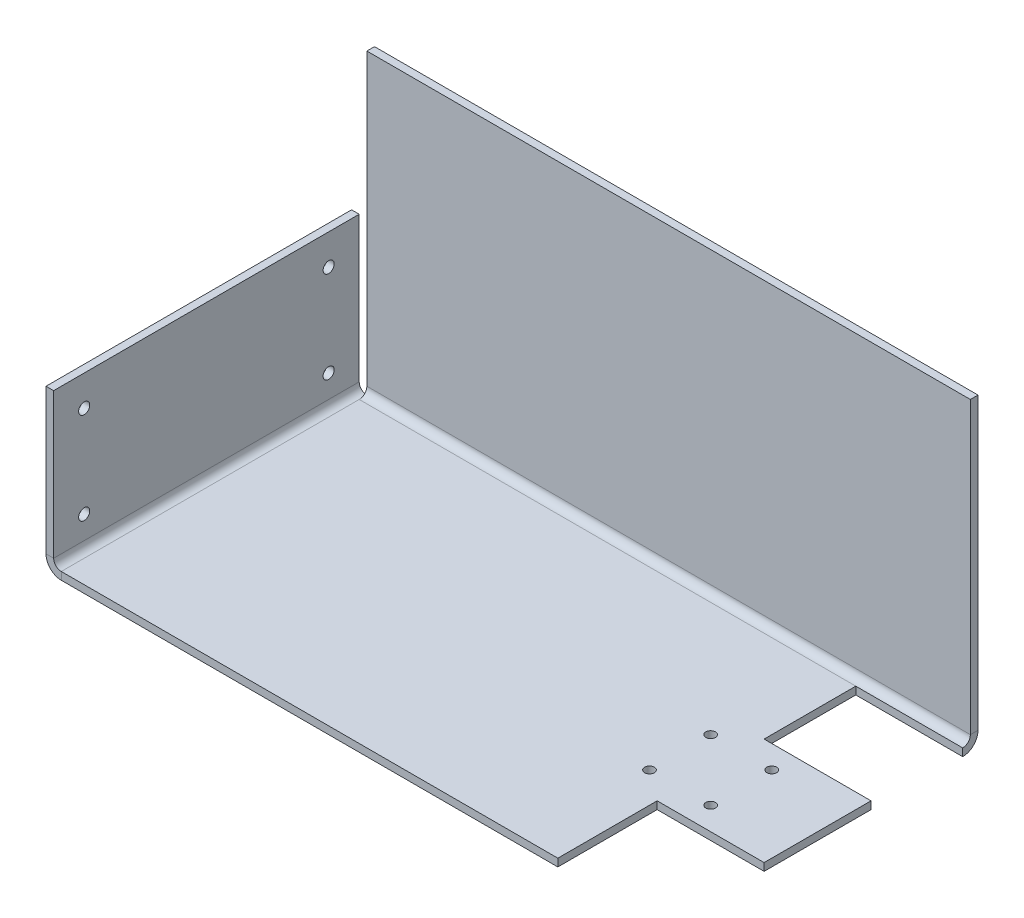
from build123d import *

# Parameters (mm, degrees)
BASE_FLANGE4_DEPTH           = 127
EDGE_FLANGE1_STRIP_W         = 19.05
EDGE_FLANGE1_STRIP_H         = 3.175
EDGE_FLANGE1_STRIP_CUT_DEPTH = 250.825
EDGE_FLANGE1_DEPTH           = 250.825
SKETCH28_W                   = 44.45
SKETCH28_H                   = 41.275
SKETCH28_H_2                 = 38.1
CUT_EXTRUDE1_DEPTH           = 312.085197333
F_10_32_TAPPED_HOLE1_D       = 4.0386
F_12_28_TAPPED_HOLE1_D       = 4.6228


# Sheet-metal steps are written as plain solids
with BuildPart() as part:
    # Sketch1 → Base-Flange4 (new body)
    with BuildSketch(Plane.XY):
        with BuildLine():
            Line((254, 0), (3.175, 0))
            ThreePointArc((3.175, 0), (0.92993597, 0.92993597), (0, 3.175))
            Line((0, 3.175), (0, 63.5))
            Line((0, 63.5), (-3.175, 63.5))
            Line((-3.175, 63.5), (-3.175, 3.175))
            ThreePointArc((-3.175, 3.175), (-1.315128061, -1.315128061), (3.175, -3.175))
            Line((3.175, -3.175), (254, -3.175))
            Line((254, -3.175), (254, 0))
        make_face()
    extrude(amount=BASE_FLANGE4_DEPTH)

    # Edge-Flange1 strip (across the edge) → Edge-Flange1 strip cut (cut)
    with BuildSketch(Plane.ZY.offset(-254)):
        with Locations((-6.35, -1.5875)):
            Rectangle(EDGE_FLANGE1_STRIP_W, EDGE_FLANGE1_STRIP_H)
    extrude(amount=EDGE_FLANGE1_STRIP_CUT_DEPTH, mode=Mode.SUBTRACT)

    # Edge-Flange1 section (across the edge) → Edge-Flange1 (add)
    with BuildSketch(Plane.ZY.offset(-254)):
        with BuildLine():
            Line((-3.175, 3.175), (-3.175, 123.825))
            Line((-3.175, 123.825), (0, 123.825))
            Line((0, 123.825), (0, 3.175))
            ThreePointArc((0, 3.175), (0.92993597, 0.92993597), (3.175, 0))
            Line((3.175, 0), (3.175, -3.175))
            ThreePointArc((3.175, -3.175), (-1.315128061, -1.315128061), (-3.175, 3.175))
        make_face()
    extrude(amount=EDGE_FLANGE1_DEPTH)

    # Sketch28 → Cut-Extrude1 (cut, through all)
    with BuildSketch(Plane.XZ.offset(3.175)):
        with Locations((231.775, 106.3625)):
            Rectangle(SKETCH28_W, SKETCH28_H)
        with Locations((231.775, 22.225)):
            Rectangle(SKETCH28_W, SKETCH28_H_2)
    extrude(amount=-CUT_EXTRUDE1_DEPTH, mode=Mode.SUBTRACT)

    # #10-32 Tapped Hole1 (through all)
    with Locations(Plane(origin=(0, -3.175, 0), x_dir=(-1, 0, 0), z_dir=(0, -1, 0))):
        with Locations((-222.25, -50.8), (-196.85, -50.8), (-196.85, -76.2), (-222.25, -76.2)):
            Hole(F_10_32_TAPPED_HOLE1_D / 2)

    # #12-28 Tapped Hole1 (through all)
    with Locations(Plane(origin=(0, 0, 0), x_dir=(0, 0, -1), z_dir=(1, 0, 0))):
        with Locations((-12.7, 50.8), (-12.7, 12.7), (-114.3, 12.7), (-114.3, 50.8)):
            Hole(F_12_28_TAPPED_HOLE1_D / 2)


solid = part.part
